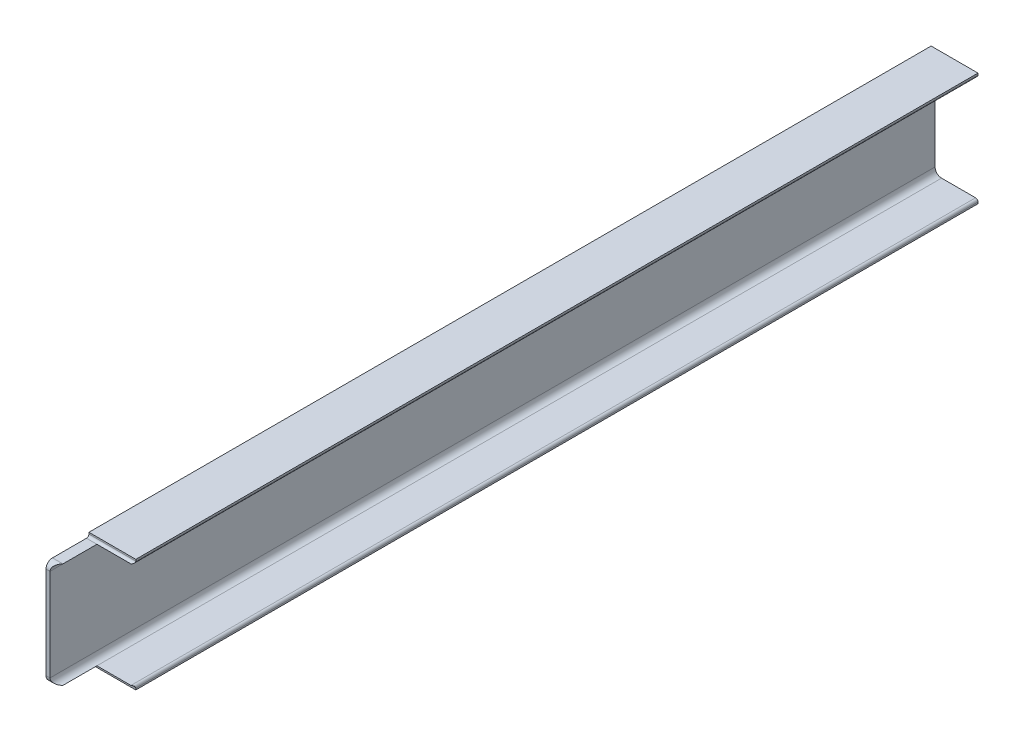
from build123d import *

# Parameters (mm, degrees)
EXTRUDE_1_DEPTH = 1100
OTHER_1_DEPTH   = 58


# Read off the part's stored shape, not the designer's step: Полость1
with BuildPart() as part:
    # Эскиз1 → Бобышка-Вытянуть1 (new body)
    with BuildSketch(Plane.XY):
        with BuildLine():
            Line((0, -140), (0, 0))
            Line((0, 0), (58, 0))
            Line((58, 0), (58, -1.9))
            ThreePointArc((58, -1.9), (57.121320344, -4.021320344), (55, -4.9))
            Line((55, -4.9), (12.9, -4.9))
            ThreePointArc((12.9, -4.9), (7.243145751, -7.243145751), (4.9, -12.9))
            Line((4.9, -12.9), (4.9, -127.1))
            ThreePointArc((4.9, -127.1), (7.243145751, -132.756854249), (12.9, -135.1))
            Line((12.9, -135.1), (55, -135.1))
            ThreePointArc((55, -135.1), (57.121320344, -135.978679656), (58, -138.1))
            Line((58, -138.1), (58, -140))
            Line((58, -140), (0, -140))
        make_face()
    extrude(amount=-EXTRUDE_1_DEPTH)

    # Полость1 outline → Полость1 (cut)
    with BuildSketch(Plane.YZ):
        with BuildLine():
            Line((-140, 0), (-140, -58))
            Line((-140, -58), (-138.1, -58))
            ThreePointArc((-138.1, -58), (-135.978679656, -57.121320344), (-135.1, -55))
            Line((-135.1, -55), (-135.1, -12.9))
            ThreePointArc((-135.1, -12.9), (-132.756854249, -7.243145751), (-127.1, -4.9))
            Line((-127.1, -4.9), (-12.9, -4.9))
            ThreePointArc((-12.9, -4.9), (-7.243145751, -7.243145751), (-4.9, -12.9))
            Line((-4.9, -12.9), (-4.9, -55))
            ThreePointArc((-4.9, -55), (-4.021320344, -57.121320344), (-1.9, -58))
            Line((-1.9, -58), (0, -58))
            Line((0, -58), (0, 0))
            Line((0, 0), (-140, 0))
        make_face()
    extrude(amount=OTHER_1_DEPTH, mode=Mode.SUBTRACT)


solid = part.part
